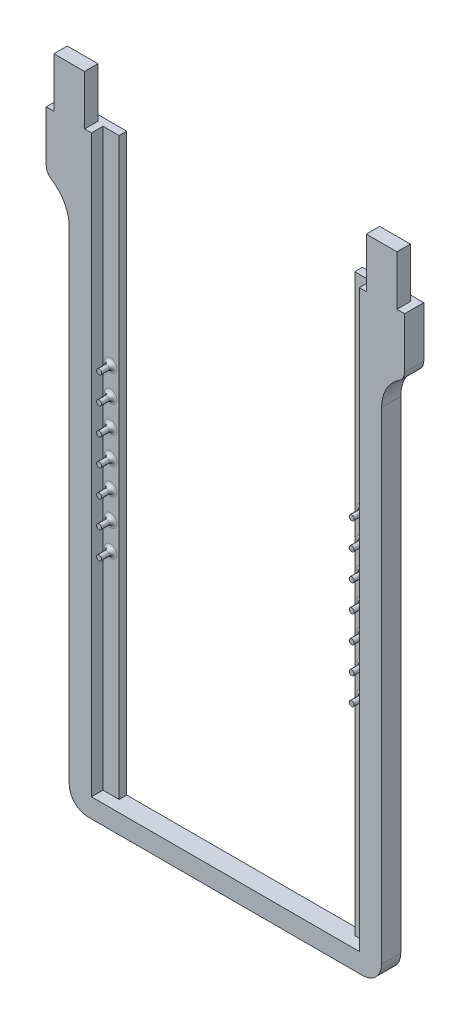
from build123d import *

# Parameters (mm, degrees)
STOCK_ARRAYRAMME_1_OUTLINE_R   = 0.65
STOCK_ARRAYRAMME_1_DEPTH       = 5
STOCK_ARRAYRAMME_1_2_OUTLINE_W = 4.2
STOCK_ARRAYRAMME_1_2_OUTLINE_H = 150
STOCK_ARRAYRAMME_1_2_OUTLINE_R = 0.65
STOCK_ARRAYRAMME_1_2_DEPTH     = 2
SKETCH1_W                      = 15
SKETCH1_H                      = 5
BOSS_EXTRUDE1_DEPTH            = 10
SKETCH2_W                      = 15
SKETCH2_H                      = 5
BOSS_EXTRUDE2_DEPTH            = 10
SKETCH3_W                      = 8
SKETCH3_H                      = 5
BOSS_EXTRUDE3_DEPTH            = 12.99
SKETCH4_W                      = 12.99
SKETCH4_H                      = 1.5
CUT_EXTRUDE1_DEPTH             = 181.061794948
FILLET5_R                      = 1
SKETCH6_W                      = 5
SKETCH6_H                      = 140
BOSS_EXTRUDE4_DEPTH            = 4
SKETCH5_W                      = 140
SKETCH5_H                      = 5
BOSS_EXTRUDE5_DEPTH            = 4
FILLET6_R                      = 10
FILLET7_R                      = 3
FILLET8_R                      = 5


# Read off the part's stored shape, not the designer's step: Stock-arrayRamme-1
with BuildPart() as part:
    # Stock-arrayRamme-1 outline → Stock-arrayRamme-1 (new body)
    with BuildSketch(Plane.XY):
        Polygon((36.75, 0), (34.95, 0), (34.95, -150), (-34.95, -150), (-34.95, 0), (-36.75, 0), (-36.75, -155), (36.75, -155), align=None)
        with Locations((-32.95, -95)):
            Circle(STOCK_ARRAYRAMME_1_OUTLINE_R)
        with Locations((-32.95, -53)):
            Circle(STOCK_ARRAYRAMME_1_OUTLINE_R)
        with Locations((-32.95, -88)):
            Circle(STOCK_ARRAYRAMME_1_OUTLINE_R)
        with Locations((-32.95, -81)):
            Circle(STOCK_ARRAYRAMME_1_OUTLINE_R)
        with Locations((-32.95, -74)):
            Circle(STOCK_ARRAYRAMME_1_OUTLINE_R)
        with Locations((-32.95, -60)):
            Circle(STOCK_ARRAYRAMME_1_OUTLINE_R)
        with Locations((-32.95, -67)):
            Circle(STOCK_ARRAYRAMME_1_OUTLINE_R)
        with Locations((32.95, -67)):
            Circle(STOCK_ARRAYRAMME_1_OUTLINE_R)
        with Locations((32.95, -60)):
            Circle(STOCK_ARRAYRAMME_1_OUTLINE_R)
        with Locations((32.95, -74)):
            Circle(STOCK_ARRAYRAMME_1_OUTLINE_R)
        with Locations((32.95, -53)):
            Circle(STOCK_ARRAYRAMME_1_OUTLINE_R)
        with Locations((32.95, -81)):
            Circle(STOCK_ARRAYRAMME_1_OUTLINE_R)
        with Locations((32.95, -88)):
            Circle(STOCK_ARRAYRAMME_1_OUTLINE_R)
        with Locations((32.95, -95)):
            Circle(STOCK_ARRAYRAMME_1_OUTLINE_R)
    extrude(amount=STOCK_ARRAYRAMME_1_DEPTH)

    # Stock-arrayRamme-1 2 outline → Stock-arrayRamme-1 2 (add)
    # profile 1 of 2: a face of its own
    with BuildSketch(Plane.XY):
        with Locations((32.85, -75)):
            Rectangle(STOCK_ARRAYRAMME_1_2_OUTLINE_W, STOCK_ARRAYRAMME_1_2_OUTLINE_H)
        with Locations((32.95, -95)):
            Circle(STOCK_ARRAYRAMME_1_2_OUTLINE_R, mode=Mode.SUBTRACT)
        with Locations((32.95, -88)):
            Circle(STOCK_ARRAYRAMME_1_2_OUTLINE_R, mode=Mode.SUBTRACT)
        with Locations((32.95, -81)):
            Circle(STOCK_ARRAYRAMME_1_2_OUTLINE_R, mode=Mode.SUBTRACT)
        with Locations((32.95, -74)):
            Circle(STOCK_ARRAYRAMME_1_2_OUTLINE_R, mode=Mode.SUBTRACT)
        with Locations((32.95, -67)):
            Circle(STOCK_ARRAYRAMME_1_2_OUTLINE_R, mode=Mode.SUBTRACT)
        with Locations((32.95, -60)):
            Circle(STOCK_ARRAYRAMME_1_2_OUTLINE_R, mode=Mode.SUBTRACT)
        with Locations((32.95, -53)):
            Circle(STOCK_ARRAYRAMME_1_2_OUTLINE_R, mode=Mode.SUBTRACT)
    # profile 2 of 2: a face of its own
    with BuildSketch(Plane.XY):
        with Locations((-32.85, -75)):
            Rectangle(STOCK_ARRAYRAMME_1_2_OUTLINE_W, STOCK_ARRAYRAMME_1_2_OUTLINE_H)
        with Locations((-32.95, -95)):
            Circle(STOCK_ARRAYRAMME_1_2_OUTLINE_R, mode=Mode.SUBTRACT)
        with Locations((-32.95, -88)):
            Circle(STOCK_ARRAYRAMME_1_2_OUTLINE_R, mode=Mode.SUBTRACT)
        with Locations((-32.95, -81)):
            Circle(STOCK_ARRAYRAMME_1_2_OUTLINE_R, mode=Mode.SUBTRACT)
        with Locations((-32.95, -74)):
            Circle(STOCK_ARRAYRAMME_1_2_OUTLINE_R, mode=Mode.SUBTRACT)
        with Locations((-32.95, -67)):
            Circle(STOCK_ARRAYRAMME_1_2_OUTLINE_R, mode=Mode.SUBTRACT)
        with Locations((-32.95, -60)):
            Circle(STOCK_ARRAYRAMME_1_2_OUTLINE_R, mode=Mode.SUBTRACT)
        with Locations((-32.95, -53)):
            Circle(STOCK_ARRAYRAMME_1_2_OUTLINE_R, mode=Mode.SUBTRACT)
    extrude(amount=STOCK_ARRAYRAMME_1_2_DEPTH)

    # Sketch1 → Boss-Extrude1 (add)
    with BuildSketch(Plane.YZ.offset(36.75)):
        with Locations((-7.5, 2.5)):
            Rectangle(SKETCH1_W, SKETCH1_H)
    extrude(amount=BOSS_EXTRUDE1_DEPTH)

    # Sketch2 → Boss-Extrude2 (add)
    with BuildSketch(Plane(origin=(-36.75, 0, 0), x_dir=(0, -1, 0), z_dir=(-1, 0, 0))):
        with Locations((7.5, 2.5)):
            Rectangle(SKETCH2_W, SKETCH2_H)
    extrude(amount=BOSS_EXTRUDE2_DEPTH)

    # Sketch3 → Boss-Extrude3 (add)
    with BuildSketch(Plane(origin=(0, 0, 0), x_dir=(-1, 0, 0), z_dir=(0, 1, 0))):
        with Locations((-40.75, 2.5)):
            Rectangle(SKETCH3_W, SKETCH3_H)
        with Locations((40.75, 2.5)):
            Rectangle(SKETCH3_W, SKETCH3_H)
    extrude(amount=BOSS_EXTRUDE3_DEPTH)

    # Sketch4 → Cut-Extrude1 (cut, through all)
    with BuildSketch(Plane(origin=(-44.75, 0, 0), x_dir=(0, -1, 0), z_dir=(-1, 0, 0))):
        with Locations((-6.495, 0.75)):
            Rectangle(SKETCH4_W, SKETCH4_H)
    extrude(amount=-CUT_EXTRUDE1_DEPTH, mode=Mode.SUBTRACT)

    # Fillet5
    fillet5_edges = [part.edges().sort_by_distance(p)[0] for p in [
        (32.3, -53, 2),
        (32.3, -74, 2),
        (32.3, -60, 2),
        (-33.6, -53, 2),
        (32.3, -67, 2),
        (-33.6, -95, 2),
        (32.3, -95, 2),
        (-33.6, -67, 2),
        (32.3, -88, 2),
        (32.3, -81, 2),
        (-33.6, -60, 2),
        (-33.6, -74, 2),
        (-33.6, -81, 2),
        (-33.6, -88, 2),
    ]]
    fillet(fillet5_edges, radius=FILLET5_R)

    # Sketch6 → Boss-Extrude4 (add)
    with BuildSketch(Plane(origin=(36.75, 0, 0), x_dir=(0, 0, -1), z_dir=(1, 0, 0))):
        with Locations((-2.5, -85)):
            Rectangle(SKETCH6_W, SKETCH6_H)
    extrude(amount=BOSS_EXTRUDE4_DEPTH)

    # Sketch5 → Boss-Extrude5 (add)
    with BuildSketch(Plane(origin=(-36.75, 0, 0), x_dir=(0, -1, 0), z_dir=(-1, 0, 0))):
        with Locations((85, 2.5)):
            Rectangle(SKETCH5_W, SKETCH5_H)
    extrude(amount=BOSS_EXTRUDE5_DEPTH)

    # Fillet6
    # the kernel refuses this fillet: 10 mm, written as the material it adds along each edge
    with BuildSketch(Plane(origin=(40.75, -15, 0), x_dir=(1, 0, 0), z_dir=(0, 0, 1))) as fillet6_piece_1:
        with BuildLine():
            CenterArc((10, -9.16515139), FILLET6_R, 113.578178478, 66.421821522)
            Line((0, -9.16515139), (-0.2, -9.16515139))
            Line((-0.2, -9.16515139), (-0.2, 0))
            Line((-0.2, 0), (0, 0.2))
            ThreePointArc((0, 0.2), (3, 0.2), (5.92, 0.183303028))
            Line((5.92, 0.183303028), (6, 0))
        make_face()
    extrude(amount=5)
    with BuildSketch(Plane(origin=(-40.75, -15, 5), x_dir=(0, -1, 0), z_dir=(0, 0, -1))) as fillet6_piece_2:
        with BuildLine():
            CenterArc((9.16515139, 10), FILLET6_R, 203.578178478, 66.421821522)
            Line((0, 6), (-0.183303028, 5.92))
            ThreePointArc((-0.183303028, 5.92), (-0.2, 3), (-0.2, 0))
            Line((-0.2, 0), (0, -0.2))
            Line((0, -0.2), (9.16515139, -0.2))
            Line((9.16515139, -0.2), (9.16515139, 0))
        make_face()
    extrude(amount=5)

    # Fillet7
    fillet7_edges = [part.edges().sort_by_distance(p)[0] for p in [
        (46.75, -15, 2.5),
        (-46.75, -15, 2.5),
    ]]
    fillet(fillet7_edges, radius=FILLET7_R)

    # Fillet8
    fillet8_edges = [part.edges().sort_by_distance(p)[0] for p in [
        (40.75, -155, 2.5),
        (-40.75, -155, 2.5),
    ]]
    fillet(fillet8_edges, radius=FILLET8_R)


solid = part.part
